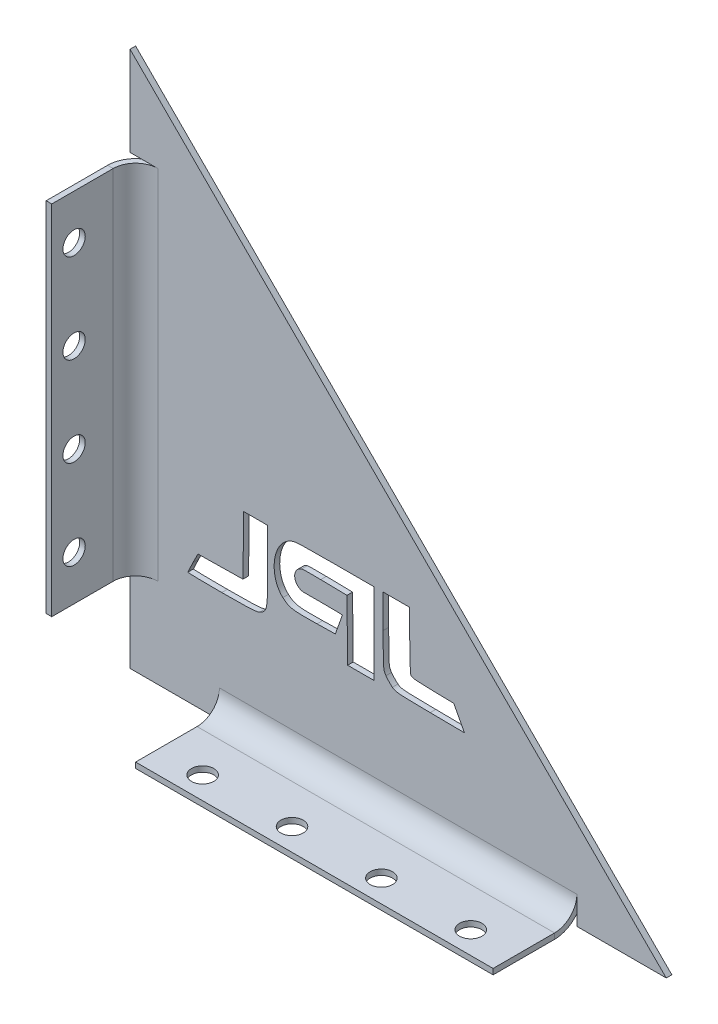
from build123d import *

# Parameters (mm, degrees)
BOSS_EXTRUDE1_DEPTH          = 1.5875
SKETCH7_W                    = 1.5875
SKETCH7_H                    = 101.6
BOSS_EXTRUDE2_DEPTH          = 0.0254
EDGE_FLANGE1_STRIP_W         = 19.05
EDGE_FLANGE1_STRIP_H         = 1.5875
EDGE_FLANGE1_STRIP_CUT_DEPTH = 101.6
EDGE_FLANGE1_DEPTH           = 101.6
SKETCH11_W                   = 101.6
SKETCH11_H                   = 1.5875
BOSS_EXTRUDE3_DEPTH          = 0.0254
EDGE_FLANGE2_STRIP_W         = 19.05
EDGE_FLANGE2_STRIP_H         = 1.5875
EDGE_FLANGE2_STRIP_CUT_DEPTH = 101.6
EDGE_FLANGE2_DEPTH           = 101.6
SKETCH15_R                   = 3.175
CUT_EXTRUDE1_DEPTH           = 2.54
SKETCH16_R                   = 3.175
CUT_EXTRUDE2_DEPTH           = 2.54
CUT_EXTRUDE6_DEPTH           = 2.54


# Sheet-metal steps are written as plain solids
with BuildPart() as part:
    # Sketch1 → Boss-Extrude1 (new body)
    with BuildSketch(Plane.XY):
        Polygon((0, 119.481843199), (0, -32.918156801), (152.4, -32.918156801), align=None)
    extrude(amount=BOSS_EXTRUDE1_DEPTH)

    # Sketch7 → Boss-Extrude2 (add)
    with BuildSketch(Plane.ZY):
        with Locations((0.79375, 43.281843199)):
            Rectangle(SKETCH7_W, SKETCH7_H)
    extrude(amount=BOSS_EXTRUDE2_DEPTH)

    # Edge-Flange1 strip (across the edge) → Edge-Flange1 strip cut (cut)
    with BuildSketch(Plane(origin=(-0.0254, 94.081843199, 1.5875), x_dir=(1, 0, 0), z_dir=(0, -1, 0))):
        with Locations((-1.5875, -0.79375)):
            Rectangle(EDGE_FLANGE1_STRIP_W, EDGE_FLANGE1_STRIP_H)
    extrude(amount=EDGE_FLANGE1_STRIP_CUT_DEPTH, mode=Mode.SUBTRACT)

    # Edge-Flange1 section (across the edge) → Edge-Flange1 (add)
    with BuildSketch(Plane(origin=(-0.0254, 94.081843199, 1.5875), x_dir=(1, 0, 0), z_dir=(0, -1, 0))):
        with BuildLine():
            Line((0, 6.35), (0, 23.8125))
            Line((0, 23.8125), (1.5875, 23.8125))
            Line((1.5875, 23.8125), (1.5875, 6.35))
            ThreePointArc((1.5875, 6.35), (3.447371939, 1.859871939), (7.9375, 0))
            Line((7.9375, 0), (7.9375, -1.5875))
            ThreePointArc((7.9375, -1.5875), (2.324839924, 0.737339924), (0, 6.35))
        make_face()
    extrude(amount=EDGE_FLANGE1_DEPTH)

    # Sketch11 → Boss-Extrude3 (add)
    with BuildSketch(Plane(origin=(0, -32.918156801, 0), x_dir=(-1, 0, 0), z_dir=(0, -1, 0))):
        with Locations((-76.2, -0.79375)):
            Rectangle(SKETCH11_W, SKETCH11_H)
    extrude(amount=BOSS_EXTRUDE3_DEPTH)

    # Edge-Flange2 strip (across the edge) → Edge-Flange2 strip cut (cut)
    with BuildSketch(Plane(origin=(25.4, -32.943556801, 1.5875), x_dir=(0, 1, 0), z_dir=(1, 0, 0))):
        with Locations((-1.5875, -0.79375)):
            Rectangle(EDGE_FLANGE2_STRIP_W, EDGE_FLANGE2_STRIP_H)
    extrude(amount=EDGE_FLANGE2_STRIP_CUT_DEPTH, mode=Mode.SUBTRACT)

    # Edge-Flange2 section (across the edge) → Edge-Flange2 (add)
    with BuildSketch(Plane(origin=(25.4, -32.943556801, 1.5875), x_dir=(0, 1, 0), z_dir=(1, 0, 0))):
        with BuildLine():
            Line((0, 6.35), (0, 23.8125))
            Line((0, 23.8125), (1.5875, 23.8125))
            Line((1.5875, 23.8125), (1.5875, 6.35))
            ThreePointArc((1.5875, 6.35), (3.447371939, 1.859871939), (7.9375, 0))
            Line((7.9375, 0), (7.9375, -1.5875))
            ThreePointArc((7.9375, -1.5875), (2.324839924, 0.737339924), (0, 6.35))
        make_face()
    extrude(amount=EDGE_FLANGE2_DEPTH)

    # Sketch15 → Cut-Extrude1 (cut)
    with BuildSketch(Plane(origin=(0, -31.356056801, 0), x_dir=(1, 0, 0), z_dir=(0, 1, 0))):
        with Locations(Location((38.1, -19.05, 0), (0, 0, 270))):
            Circle(SKETCH15_R)
        with Locations(Location((63.5, -19.05, 0), (0, 0, 270))):
            Circle(SKETCH15_R)
        with Locations(Location((88.9, -19.05, 0), (0, 0, 270))):
            Circle(SKETCH15_R)
        with Locations(Location((114.3, -19.05, 0), (0, 0, 270))):
            Circle(SKETCH15_R)
    extrude(amount=-CUT_EXTRUDE1_DEPTH, mode=Mode.SUBTRACT)

    # Sketch16 → Cut-Extrude2 (cut)
    with BuildSketch(Plane(origin=(1.5621, 0, 0), x_dir=(0, 0, -1), z_dir=(1, 0, 0))):
        with Locations((-19.05, 81.381843199)):
            Circle(SKETCH16_R)
        with Locations((-19.05, 55.981843199)):
            Circle(SKETCH16_R)
        with Locations((-19.05, 30.581843199)):
            Circle(SKETCH16_R)
        with Locations((-19.05, 5.181843199)):
            Circle(SKETCH16_R)
    extrude(amount=-CUT_EXTRUDE2_DEPTH, mode=Mode.SUBTRACT)

    # Sketch23 → Cut-Extrude6 (cut)
    with BuildSketch(Plane(origin=(0, 0, 0), x_dir=(-1, 0, 0), z_dir=(0, 0, -1))):
        with BuildLine():
            Line((-54.573395113, 10.50380224), (-49.145810825, 10.50380224))
            ThreePointArc((-49.145810825, 10.50380224), (-46.796706145, 13.083281254), (-48.781433081, 15.952577991))
            add(Edge.make_bspline(
                [(-48.781433081, 15.952577991), (-49.604210691, 16.082970195), (-51.083841149, 16.078342253), (-54.195922097, 16.035293361)],
                knots=[0.430340986, 0.430340986, 0.430340986, 0.430340986, 1, 1, 1, 1], degree=3))
            Line((-54.195922097, 16.035293361), (-61.650359925, 15.903259941))
            Line((-61.650359925, 15.903259941), (-61.746981527, 7.343931221))
            Line((-61.746981527, 7.343931221), (-61.843602617, -1.215397719))
            Line((-61.843602617, -1.215397719), (-65.621203901, -1.215397719))
            Line((-65.621203901, -1.215397719), (-69.398804677, -1.215397719))
            Line((-69.398804677, -1.215397719), (-69.398822965, 10.317171545))
            Line((-69.398822965, 10.317171545), (-69.398822965, 21.849740809))
            Line((-69.398822965, 21.849740809), (-58.122813005, 21.849740809))
            add(Edge.make_bspline(
                [(-58.122813005, 21.849740809), (-47.145028509, 21.849740809), (-46.804351517, 21.828297113), (-45.241678493, 21.038856985)],
                knots=[0, 0, 0, 0, 1, 1, 1, 1], degree=3))
            add(Edge.make_bspline(
                [(-45.241678493, 21.038856985), (-40.484510461, 18.635606521), (-39.407981245, 9.867736325), (-43.424538109, 6.239017141)],
                knots=[0, 0, 0, 0, 1, 1, 1, 1], degree=3))
            add(Edge.make_bspline(
                [(-43.424538109, 6.239017141), (-45.171541981, 4.660705845), (-46.271260381, 4.477914745), (-53.152055357, 4.622150677)],
                knots=[0, 0, 0, 0, 1, 1, 1, 1], degree=3))
            Line((-53.152055357, 4.622150677), (-58.348663709, 4.731083149))
            Line((-58.348663709, 4.731083149), (-60.339924976, 10.364052271))
            add(Edge.make_bspline(
                [(-60.339924976, 10.364052271), (-60.339785544, 10.446289733), (-57.744845223, 10.50917935), (-54.573395113, 10.50380224)],
                knots=[0, 0, 0, 0, 1, 1, 1, 1], degree=3))
        make_face()
        with BuildLine():
            Line((-93.522388131, 1.627502866), (-91.989800897, 4.503859321))
            Line((-91.989800897, 4.503859321), (-86.086398429, 4.617469457))
            add(Edge.make_bspline(
                [(-86.086398429, 4.617469457), (-81.318957113, 4.709221877), (-80.117365409, 4.835103769), (-79.841927301, 5.271672365)],
                knots=[0, 0, 0, 0, 1, 1, 1, 1], degree=3))
            add(Edge.make_bspline(
                [(-79.841927301, 5.271672365), (-79.654305121, 5.569050485), (-79.498376553, 9.419876413), (-79.495340745, 13.831000941)],
                knots=[0, 0, 0, 0, 1, 1, 1, 1], degree=3))
            Line((-79.495340745, 13.831000941), (-79.489821833, 21.849740809))
            Line((-79.489821833, 21.849740809), (-75.705697829, 21.849740809))
            Line((-75.705697829, 21.849740809), (-71.921573317, 21.849740809))
            Line((-71.921573317, 21.849740809), (-71.921573317, 12.352626453))
            add(Edge.make_bspline(
                [(-71.921573317, 12.352626453), (-71.921573317, 3.097047809), (-71.942194053, 2.825210913), (-72.732457141, 1.664079377)],
                knots=[0, 0, 0, 0, 1, 1, 1, 1], degree=3))
            add(Edge.make_bspline(
                [(-72.732457141, 1.664079377), (-73.178443041, 1.008787825), (-74.000851861, 0.133375809), (-74.560031337, -0.281281223)],
                knots=[0, 0, 0, 0, 1, 1, 1, 1], degree=3))
            add(Edge.make_bspline(
                [(-74.560031337, -0.281281223), (-75.523356309, -0.995630315), (-76.087920585, -1.040808787), (-85.315848789, -1.142028803)],
                knots=[0, 0, 0, 0, 1, 1, 1, 1], degree=3))
            Line((-85.315848789, -1.142028803), (-95.054974853, -1.248853075))
            Line((-95.054974853, -1.248853075), (-93.522388131, 1.627502866))
        make_face()
        with BuildLine():
            Line((-39.125829917, 11.921041845), (-39.125829917, 21.849740809))
            Line((-39.125829917, 21.849740809), (-35.708737437, 21.849740809))
            Line((-35.708737437, 21.849740809), (-32.291649021, 21.849740809))
            Line((-32.291649021, 21.849740809), (-32.194909565, 13.470608469))
            Line((-32.194909565, 13.470608469), (-32.098170109, 5.091476129))
            Line((-32.098170109, 5.091476129), (-25.701039901, 4.993059765))
            Line((-25.701039901, 4.993059765), (-19.303905629, 4.894643909))
            Line((-19.303905629, 4.894643909), (-17.862494237, 2.027820585))
            add(Edge.make_bspline(
                [(-17.862494237, 2.027820585), (-17.069717565, 0.451065801), (-16.421082845, -0.923695483), (-16.421082845, -1.027204039)],
                knots=[0, 0, 0, 0, 1, 1, 1, 1], degree=3))
            add(Edge.make_bspline(
                [(-16.421082845, -1.027204039), (-16.421082845, -1.130712595), (-20.759309373, -1.211707099), (-26.061589853, -1.207191487)],
                knots=[0, 0, 0, 0, 1, 1, 1, 1], degree=3))
            add(Edge.make_bspline(
                [(-26.061589853, -1.207191487), (-34.226807965, -1.200233919), (-35.884200637, -1.109240451), (-36.892080765, -0.612529227)],
                knots=[0, 0, 0, 0, 1, 1, 1, 1], degree=3))
            add(Edge.make_bspline(
                [(-36.892080765, -0.612529227), (-39.040522493, 0.446283489), (-39.125829917, 0.924935313), (-39.125829917, 11.921041845)],
                knots=[0, 0, 0, 0, 1, 1, 1, 1], degree=3))
        make_face()
    extrude(amount=-CUT_EXTRUDE6_DEPTH, mode=Mode.SUBTRACT)


solid = part.part
